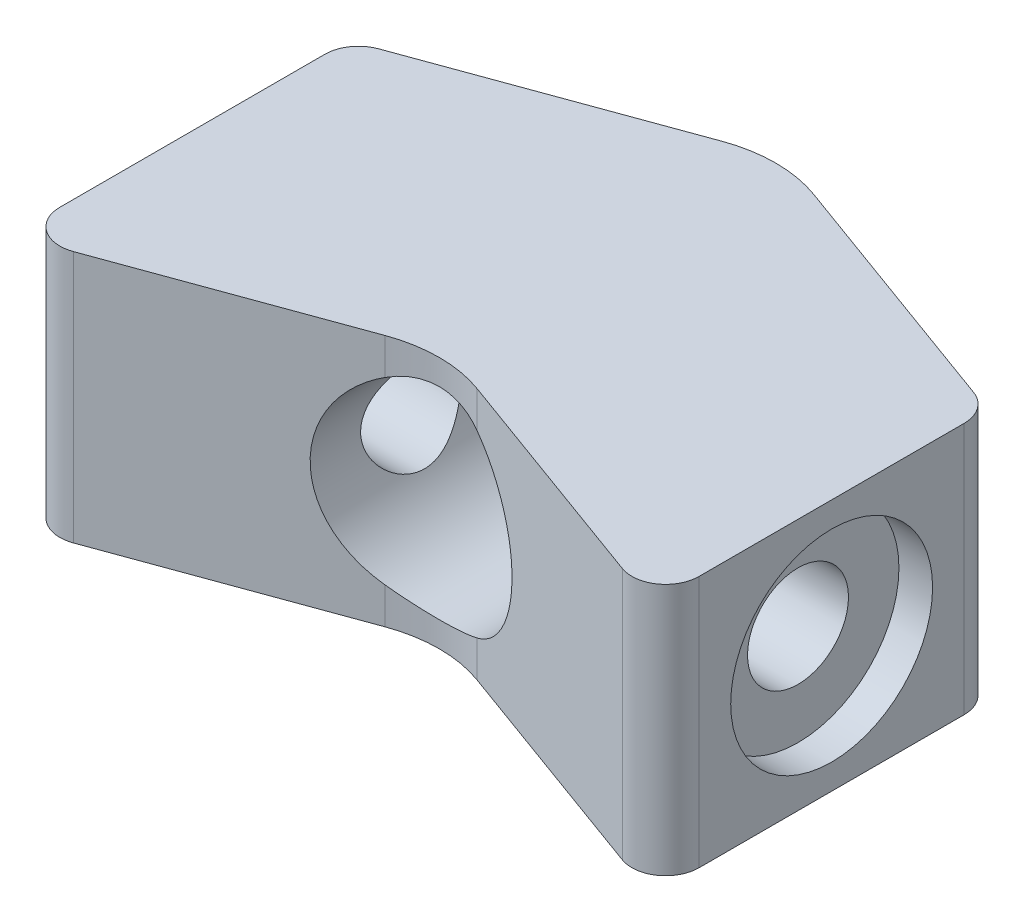
from build123d import *

# Parameters (mm, degrees)
EXTRUDE_1_DEPTH          = 15
CUT_EXTRUDE_1_DEPTH      = 30.901200214
CUT_EXTRUDE_1_DEPTH_BACK = 15
SKETCH_2_R               = 6
SKETCH_4_R               = 3
CUT_EXTRUDE_4_DEPTH      = 20
SKETCH_4_5_R             = 6
SKETCH_4_5_R_2           = 3
CUT_EXTRUDE_5_DEPTH      = 2


with BuildPart() as part:
    # 草图1 → 凸台-拉伸1 (new body)
    with BuildSketch(Plane(origin=(0, 0, 0), x_dir=(1, 0, 0), z_dir=(0, 1, 0))):
        with BuildLine():
            Line((-2.736161147, 7.517540966), (-17.684040287, 2.076957894))
            ThreePointArc((-17.684040287, 2.076957894), (-18.638304089, 1.344725525), (-19, 0.197572652))
            Line((-19, 0.197572652), (-19, -15.55225838))
            ThreePointArc((-19, -15.55225838), (-18.147152873, -17.190562469), (-16.315959713, -17.431643622))
            Line((-16.315959713, -17.431643622), (-2.736161147, -12.489001156))
            ThreePointArc((-2.736161147, -12.489001156), (0, -12.006542123), (2.736161147, -12.489001156))
            Line((2.736161147, -12.489001156), (16.315959713, -17.431643622))
            ThreePointArc((16.315959713, -17.431643622), (18.147152873, -17.190562469), (19, -15.55225838))
            Line((19, -15.55225838), (19, 0.197572652))
            ThreePointArc((19, 0.197572652), (18.638304089, 1.344725525), (17.684040287, 2.076957894))
            Line((17.684040287, 2.076957894), (2.736161147, 7.517540966))
            ThreePointArc((2.736161147, 7.517540966), (0, 8), (-2.736161147, 7.517540966))
        make_face()
    extrude(amount=EXTRUDE_1_DEPTH)

    # 草图2 → 切除-拉伸1 (cut, two sides: drawn at the far end of the back side and taken through both)
    with BuildSketch(Plane.XY.offset(-CUT_EXTRUDE_1_DEPTH_BACK)):
        with Locations((0, 7.5)):
            Circle(SKETCH_2_R)
    extrude(amount=CUT_EXTRUDE_1_DEPTH + CUT_EXTRUDE_1_DEPTH_BACK, mode=Mode.SUBTRACT)

    # 草图4 → 切除-拉伸4 (cut)
    with BuildSketch(Plane.ZY.offset(19)):
        with Locations((7.677342864, 7.5)):
            Circle(SKETCH_4_R)
    cut_extrude_4 = extrude(amount=-CUT_EXTRUDE_4_DEPTH, mode=Mode.SUBTRACT)

    # 草图4<5> → 切除-拉伸5 (cut)
    with BuildSketch(Plane.ZY.offset(19)):
        with Locations((7.677342864, 7.5)):
            Circle(SKETCH_4_5_R)
        with Locations((7.677342864, 7.5)):
            Circle(SKETCH_4_5_R_2, mode=Mode.SUBTRACT)
    cut_extrude_5 = extrude(amount=-CUT_EXTRUDE_5_DEPTH, mode=Mode.SUBTRACT)

    # 镜向1: 切除-拉伸4, 切除-拉伸5 across plane
    add(cut_extrude_4.mirror(Plane(origin=(0, 0, 0), x_dir=(0, 0, 1), z_dir=(1, 0, 0))), mode=Mode.SUBTRACT)
    add(cut_extrude_5.mirror(Plane(origin=(0, 0, 0), x_dir=(0, 0, 1), z_dir=(1, 0, 0))), mode=Mode.SUBTRACT)


solid = part.part
